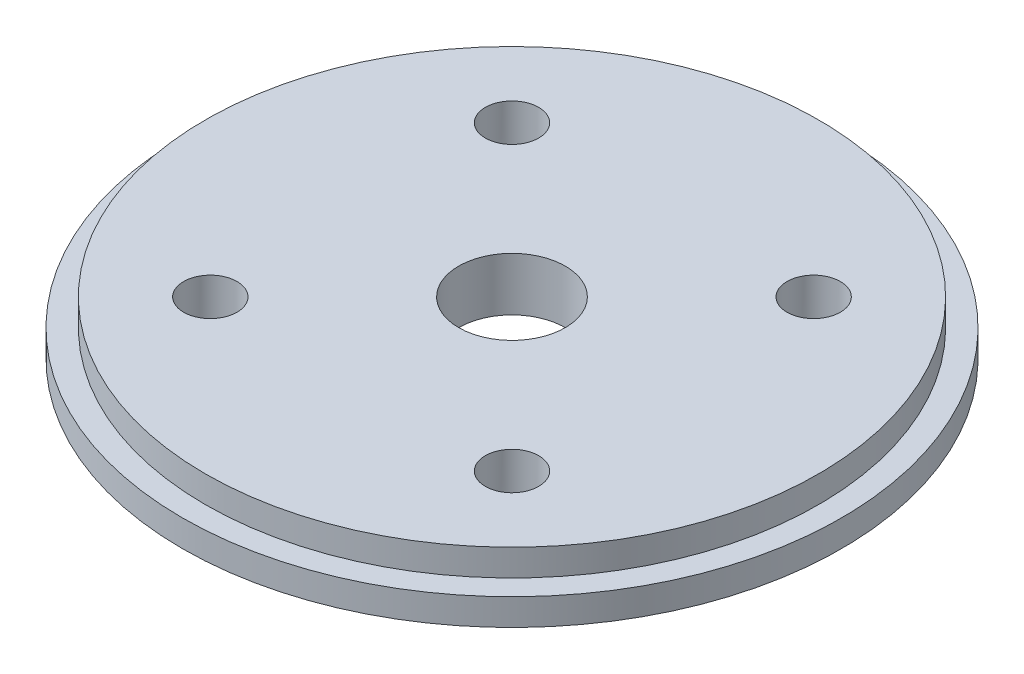
from build123d import *

# Parameters (mm, degrees)
SKETCH2_R                   = 39.243
BOSS_EXTRUDE1_DEPTH         = 6.35
CUT_EXTRUDE1_START          = -3.175
SKETCH4_R                   = 39.243
SKETCH4_R_2                 = 36.5125
CUT_EXTRUDE1_DEPTH          = 3.175
F_1_4_0_25_DIAMETER_HOLE1_D = 6.35
F_1_2_0_5_DIAMETER_HOLE1_D  = 12.7
SKETCH9_R                   = 6.35
CUT_EXTRUDE2_DEPTH          = 1.5875


with BuildPart() as part:
    # Sketch2 → Boss-Extrude1 (new body)
    with BuildSketch(Plane(origin=(0, 0, 0), x_dir=(1, 0, 0), z_dir=(0, 1, 0))):
        Circle(SKETCH2_R)
    extrude(amount=BOSS_EXTRUDE1_DEPTH)

    # Sketch4 → Cut-Extrude1 (cut)
    with BuildSketch(Plane(origin=(0, 6.35, 0), x_dir=(1, 0, 0), z_dir=(0, 1, 0)).offset(CUT_EXTRUDE1_START)):
        Circle(SKETCH4_R)
        Circle(SKETCH4_R_2, mode=Mode.SUBTRACT)
    extrude(amount=CUT_EXTRUDE1_DEPTH, mode=Mode.SUBTRACT)

    # 1/4 (0.25) Diameter Hole1 (through all)
    with Locations(Plane(origin=(0, 6.35, 0), x_dir=(1, 0, 0), z_dir=(0, 1, 0))):
        with Locations((-17.960512242, 17.960512242), (-17.960512242, -17.960512242), (17.960512242, 17.960512242), (17.960512242, -17.960512242)):
            Hole(F_1_4_0_25_DIAMETER_HOLE1_D / 2)

    # 1/2 (0.5) Diameter Hole1 (through all)
    with Locations(Plane(origin=(0, 6.35, 0), x_dir=(1, 0, 0), z_dir=(0, 1, 0))):
        with Locations((0, 0)):
            Hole(F_1_2_0_5_DIAMETER_HOLE1_D / 2)

    # Sketch9 → Cut-Extrude2 (cut)
    with BuildSketch(Plane.XZ):
        with Locations((-17.960512242, 17.960512242)):
            Circle(SKETCH9_R)
        with Locations((17.960512242, 17.960512242)):
            Circle(SKETCH9_R)
        with Locations((17.960512242, -17.960512242)):
            Circle(SKETCH9_R)
        with Locations((-17.960512242, -17.960512242)):
            Circle(SKETCH9_R)
    extrude(amount=-CUT_EXTRUDE2_DEPTH, mode=Mode.SUBTRACT)


solid = part.part
